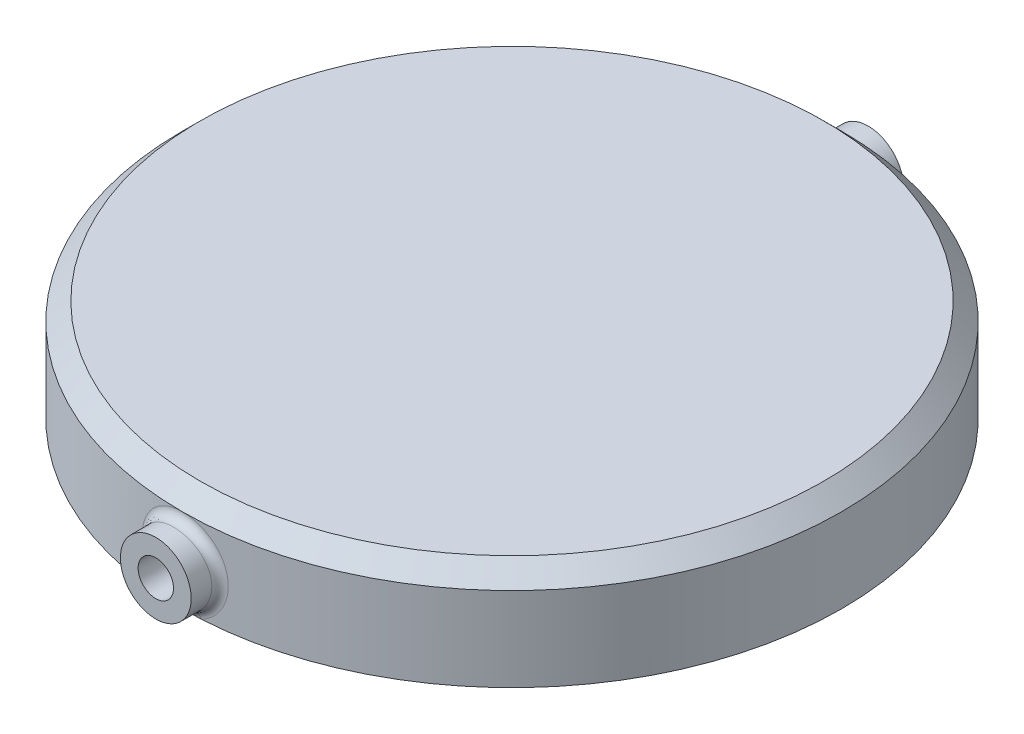
from build123d import *

# Parameters (mm, degrees)
SKETCH1_R           = 37.25
SKETCH1_R_2         = 35.5
BOSS_EXTRUDE1_DEPTH = 10
BOSS_EXTRUDE2_START = 1.5
SKETCH1_2_R         = 37.25
SKETCH1_2_R_2       = 35.5
SKETCH1_2_R_3       = 30
BOSS_EXTRUDE2_DEPTH = 1.5
CHAMFER1_SIZE       = 1.5
CHAMFER2_SIZE       = 2
CUT_EXTRUDE1_DEPTH  = 10
BOSS_EXTRUDE4_START = 3
BOSS_EXTRUDE4_DEPTH = 4
BOSS_EXTRUDE6_START = -1
BOSS_EXTRUDE6_DEPTH = 5
FILLET1_R           = 1


with BuildPart() as part:
    # Sketch1 → Boss-Extrude1 (new body)
    with BuildSketch(Plane(origin=(0, 0, 0), x_dir=(1, 0, 0), z_dir=(0, 1, 0))):
        with Locations(Location((0, 0, 0), (0, 0, 270))):
            Circle(SKETCH1_R)
        with Locations(Location((0, 0, 0), (0, 0, 270))):
            Circle(SKETCH1_R_2, mode=Mode.SUBTRACT)
    extrude(amount=-BOSS_EXTRUDE1_DEPTH)

    # Sketch1<2> → Boss-Extrude2 (add)
    # profile 1 of 3: a face of its own
    with BuildSketch(Plane(origin=(0, 0, 0), x_dir=(1, 0, 0), z_dir=(0, 1, 0)).offset(BOSS_EXTRUDE2_START)):
        with Locations(Location((0, 0, 0), (0, 0, 270))):
            Circle(SKETCH1_2_R)
        with Locations(Location((0, 0, 0), (0, 0, 270))):
            Circle(SKETCH1_2_R_2, mode=Mode.SUBTRACT)
    # profile 2 of 3: a face of its own
    with BuildSketch(Plane(origin=(0, 0, 0), x_dir=(1, 0, 0), z_dir=(0, 1, 0)).offset(BOSS_EXTRUDE2_START)):
        with Locations(Location((0, 0, 0), (0, 0, 270))):
            Circle(SKETCH1_2_R_2)
    # profile 3 of 3: a face of its own
    with BuildSketch(Plane(origin=(0, 0, 0), x_dir=(1, 0, 0), z_dir=(0, 1, 0)).offset(BOSS_EXTRUDE2_START)):
        Circle(SKETCH1_2_R_3)
    extrude(amount=-BOSS_EXTRUDE2_DEPTH)

    # Chamfer1
    chamfer1_edges = [part.edges().sort_by_distance(p)[0] for p in [
        (0, 0, -35.5),
    ]]
    chamfer(chamfer1_edges, length=CHAMFER1_SIZE)

    # Chamfer2
    chamfer2_edges = [part.edges().sort_by_distance(p)[0] for p in [
        (0, 1.5, -37.25),
    ]]
    chamfer(chamfer2_edges, length=CHAMFER2_SIZE)

    # Sketch2 → Cut-Extrude1 (cut)
    with BuildSketch(Plane.XY.offset(37.25)):
        with BuildLine():
            ThreePointArc((2, -5.5), (1.414213562, -4.085786438), (0, -3.5))
            Line((0, -3.5), (0, -7.5))
            ThreePointArc((0, -7.5), (1.414213562, -6.914213562), (2, -5.5))
        make_face()
        with BuildLine():
            Line((0, -7.5), (0, -3.5))
            ThreePointArc((0, -3.5), (-2, -5.5), (0, -7.5))
        make_face()
    cut_extrude1 = extrude(amount=-CUT_EXTRUDE1_DEPTH, mode=Mode.SUBTRACT)

    # Sketch2<3> → Boss-Extrude4 (add)
    with BuildSketch(Plane.XY.offset(37.25).offset(BOSS_EXTRUDE4_START)):
        with BuildLine():
            ThreePointArc((4, -5.5), (2.828427125, -2.671572875), (0, -1.5))
            Line((0, -1.5), (0, -3.5))
            ThreePointArc((0, -3.5), (1.414213562, -4.085786438), (2, -5.5))
            ThreePointArc((2, -5.5), (1.414213562, -6.914213562), (0, -7.5))
            Line((0, -7.5), (0, -9.5))
            ThreePointArc((0, -9.5), (2.828427125, -8.328427125), (4, -5.5))
        make_face()
        with BuildLine():
            Line((0, -3.5), (0, -1.5))
            ThreePointArc((0, -1.5), (-4, -5.5), (0, -9.5))
            Line((0, -9.5), (0, -7.5))
            ThreePointArc((0, -7.5), (-2, -5.5), (0, -3.5))
        make_face()
    boss_extrude4 = extrude(amount=-BOSS_EXTRUDE4_DEPTH)

    # Mirror1: Cut-Extrude1, Boss-Extrude4 across plane
    add(cut_extrude1.mirror(Plane.XY), mode=Mode.SUBTRACT)
    add(boss_extrude4.mirror(Plane.XY))

    # tirangle → Boss-Extrude6 (add)
    with BuildSketch(Plane(origin=(37.25, 0, 0), x_dir=(0, 0, -1), z_dir=(1, 0, 0)).offset(BOSS_EXTRUDE6_START)):
        Polygon((2.5, -0.5), (-2.5, -0.5), (0, -3), align=None)
    boss_extrude6 = extrude(amount=-BOSS_EXTRUDE6_DEPTH)

    # Mirror2: Boss-Extrude6 across plane
    add(boss_extrude6.mirror(Plane(origin=(0, 0, 0), x_dir=(0, 0, 1), z_dir=(1, 0, 0))))

    # Fillet1
    fillet1_edges = [part.edges().sort_by_distance(p)[0] for p in [
        (-4, -5.500000006, 37.034612189),
        (-4.8e-08, -9.5, -37.25),
    ]]
    fillet(fillet1_edges, radius=FILLET1_R - 0.0001)  # a hair under: the kernel refuses the full size


solid = part.part
